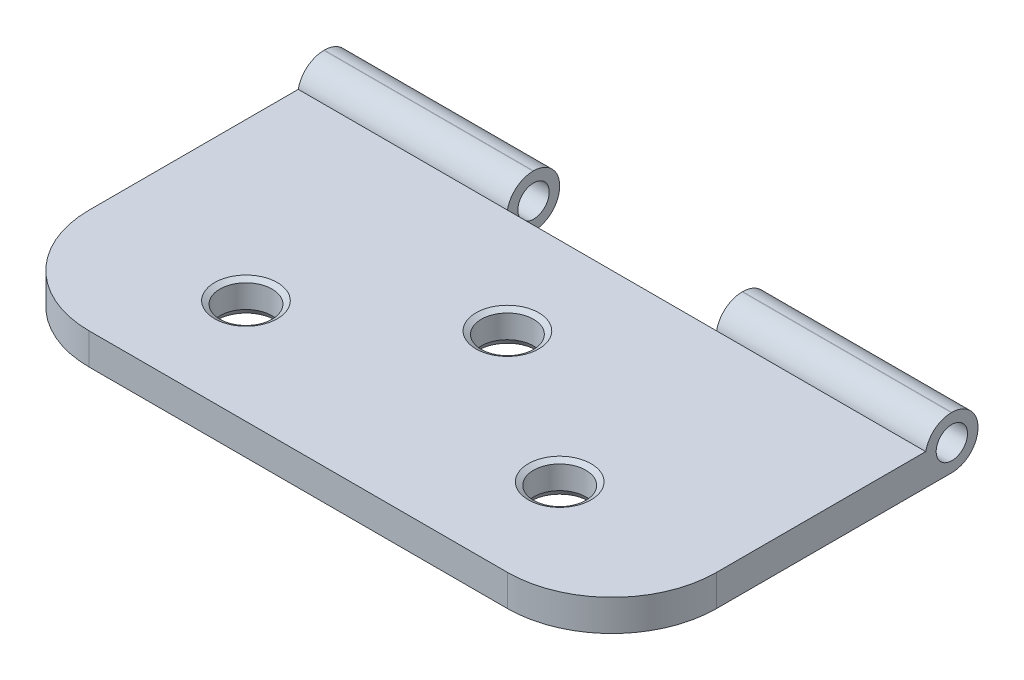
from build123d import *
from OCP.BRepFilletAPI import BRepFilletAPI_MakeChamfer

# Parameters (mm, degrees)
SZKIC1_W                    = 60
SZKIC1_H                    = 30
DODANIE_WYCI_GNI_CIE1_DEPTH = 3
SZKIC2_R                    = 2.5
WYTNIJ_WYCI_GNI_CIE1_DEPTH  = 5
SZKIC4_W                    = 20
SZKIC4_H                    = 3
DODANIE_WYCI_GNI_CIE2_DEPTH = 5
SZKIC5_W                    = 20
SZKIC5_H                    = 5
DODANIE_WYCI_GNI_CIE3_DEPTH = 2
ZAOKR_GLENIE1_R             = 2.5
SZKIC6_R                    = 1.5
WYTNIJ_WYCI_GNI_CIE2_DEPTH  = 60
ZAOKR_GLENIE2_R             = 10
SFAZOWANIE1_SIZE            = 0.5
SFAZOWANIE1_SIZE2           = 0.288675135


with BuildPart() as part:
    # Szkic1 → Dodanie-wyciągnięcie1 (new body)
    with BuildSketch(Plane(origin=(0, 0, 0), x_dir=(1, 0, 0), z_dir=(0, 1, 0))):
        Rectangle(SZKIC1_W, SZKIC1_H)
    extrude(amount=DODANIE_WYCI_GNI_CIE1_DEPTH)

    # Szkic2 → Wytnij-wyciągnięcie1 (cut)
    with BuildSketch(Plane(origin=(0, 3, 0), x_dir=(1, 0, 0), z_dir=(0, 1, 0))):
        with Locations(Location((-15, -5, 0), (0, 0, 270))):
            Circle(SZKIC2_R)
        with Locations(Location((15, -5, 0), (0, 0, 270))):
            Circle(SZKIC2_R)
        with Locations(Location((0, 5, 0), (0, 0, 270))):
            Circle(SZKIC2_R)
    extrude(amount=-WYTNIJ_WYCI_GNI_CIE1_DEPTH, mode=Mode.SUBTRACT)

    # Szkic4 → Dodanie-wyciągnięcie2 (add)
    with BuildSketch(Plane(origin=(0, 0, -15), x_dir=(-1, 0, 0), z_dir=(0, 0, -1))):
        with Locations((-20, 1.5)):
            Rectangle(SZKIC4_W, SZKIC4_H)
        with Locations((20, 1.5)):
            Rectangle(SZKIC4_W, SZKIC4_H)
    extrude(amount=DODANIE_WYCI_GNI_CIE2_DEPTH)

    # Szkic5 → Dodanie-wyciągnięcie3 (add)
    with BuildSketch(Plane(origin=(0, 3, 0), x_dir=(1, 0, 0), z_dir=(0, 1, 0))):
        with Locations((-20, 17.5)):
            Rectangle(SZKIC5_W, SZKIC5_H)
        with Locations((20, 17.5)):
            Rectangle(SZKIC5_W, SZKIC5_H)
    extrude(amount=DODANIE_WYCI_GNI_CIE3_DEPTH)

    # Zaokrąglenie1
    # the kernel refuses this fillet: 2.5 mm, written as the material it takes off along each edge
    with BuildSketch(Plane(origin=(-36.25, 0, -20), x_dir=(0, 1, 0), z_dir=(1, 0, 0)), Plane(origin=(-36.25, 5, -20), x_dir=(0, 0, 1), z_dir=(1, 0, 0)), Plane(origin=(3.75, 5, -20), x_dir=(0, 0, 1), z_dir=(1, 0, 0))) as zaokr_glenie1_piece_1:
        with BuildLine():
            CenterArc((ZAOKR_GLENIE1_R, ZAOKR_GLENIE1_R), ZAOKR_GLENIE1_R, 180, 90)
            Line((0, ZAOKR_GLENIE1_R), (-ZAOKR_GLENIE1_R * 0.02, ZAOKR_GLENIE1_R))
            Line((-ZAOKR_GLENIE1_R * 0.02, ZAOKR_GLENIE1_R), (-ZAOKR_GLENIE1_R * 0.02, -ZAOKR_GLENIE1_R * 0.02))
            Line((-ZAOKR_GLENIE1_R * 0.02, -ZAOKR_GLENIE1_R * 0.02), (ZAOKR_GLENIE1_R, -ZAOKR_GLENIE1_R * 0.02))
            Line((ZAOKR_GLENIE1_R, -ZAOKR_GLENIE1_R * 0.02), (ZAOKR_GLENIE1_R, 0))
        make_face()
    extrude(amount=32.5, mode=Mode.SUBTRACT)
    with BuildSketch(Plane(origin=(-3.876275643, 5, -15), x_dir=(0, -1.0, -1.666222715356868e-12), z_dir=(-1, 0, 0)), Plane(origin=(36.123724357, 5, -15), x_dir=(0, -1.0, -1.666222715356868e-12), z_dir=(-1, 0, 0))) as zaokr_glenie1_piece_2:
        with BuildLine():
            CenterArc((2.5, -2.449489743), ZAOKR_GLENIE1_R, 101.536959033, 78.463040967)
            Line((0, -2.449489743), (-0.05, -2.449489743))
            Line((-0.05, -2.449489743), (-0.05, 0))
            Line((-0.05, 0), (0, 0.05))
            ThreePointArc((0, 0.05), (1, 0.05), (1.99, 0.048989795))
            Line((1.99, 0.048989795), (2, 0))
        make_face()
    extrude(amount=32.247448714, mode=Mode.SUBTRACT)
    with BuildSketch(Plane(origin=(36.25, 0, -20), x_dir=(0, 1, 0), z_dir=(-1, 0, 0))) as zaokr_glenie1_piece_3:
        with BuildLine():
            CenterArc((ZAOKR_GLENIE1_R, -ZAOKR_GLENIE1_R), ZAOKR_GLENIE1_R, 90, 90)
            Line((0, -ZAOKR_GLENIE1_R), (-ZAOKR_GLENIE1_R * 0.02, -ZAOKR_GLENIE1_R))
            Line((-ZAOKR_GLENIE1_R * 0.02, -ZAOKR_GLENIE1_R), (-ZAOKR_GLENIE1_R * 0.02, ZAOKR_GLENIE1_R * 0.02))
            Line((-ZAOKR_GLENIE1_R * 0.02, ZAOKR_GLENIE1_R * 0.02), (ZAOKR_GLENIE1_R, ZAOKR_GLENIE1_R * 0.02))
            Line((ZAOKR_GLENIE1_R, ZAOKR_GLENIE1_R * 0.02), (ZAOKR_GLENIE1_R, 0))
        make_face()
    extrude(amount=32.5, mode=Mode.SUBTRACT)

    # Szkic6 → Wytnij-wyciągnięcie2 (cut)
    with BuildSketch(Plane(origin=(30, 0, 0), x_dir=(0, 0, -1), z_dir=(1, 0, 0))):
        with Locations((17.5, 2.5)):
            Circle(SZKIC6_R)
    extrude(amount=-WYTNIJ_WYCI_GNI_CIE2_DEPTH, mode=Mode.SUBTRACT)

    # Zaokrąglenie2
    zaokr_glenie2_edges = [part.edges().sort_by_distance(p)[0] for p in [
        (30, 1.5, 15),
        (-30, 1.5, 15),
    ]]
    fillet(zaokr_glenie2_edges, radius=ZAOKR_GLENIE2_R)

    # Sfazowanie1: one chamfer whose edges measure the first distance from different faces: ONE call of the kernel's chamfer builder (chamfer() names one face for all edges)
    sfazowanie1_edges_1 = [part.edges().sort_by_distance(p)[0] for p in [
        (-15, 0, 2.5),
    ]]
    sfazowanie1_side_1 = [part.faces().sort_by_distance(p)[0] for p in [
        (-15, 1.5, 2.5),
    ]]
    sfazowanie1_edges_2 = [part.edges().sort_by_distance(p)[0] for p in [
        (-15, 3, 2.5),
        (15, 3, 2.5),
        (0, 3, -7.5),
    ]]
    sfazowanie1_side_2 = [part.faces().sort_by_distance(p)[0] for p in [
        (0, 3, -0.380473171),
    ]]
    sfazowanie1_edges_3 = [part.edges().sort_by_distance(p)[0] for p in [
        (15, 0, 2.5),
    ]]
    sfazowanie1_side_3 = [part.faces().sort_by_distance(p)[0] for p in [
        (15, 1.5, 2.5),
    ]]
    sfazowanie1_edges_4 = [part.edges().sort_by_distance(p)[0] for p in [
        (0, 0, -7.5),
    ]]
    sfazowanie1_side_4 = [part.faces().sort_by_distance(p)[0] for p in [
        (0, 1.5, -7.5),
    ]]
    sfazowanie1 = BRepFilletAPI_MakeChamfer(part.part.solid().wrapped)
    for e in sfazowanie1_edges_1:
        sfazowanie1.Add(SFAZOWANIE1_SIZE, SFAZOWANIE1_SIZE2, e.wrapped, sfazowanie1_side_1[0].wrapped)  # the first distance lies on this face
    for e in sfazowanie1_edges_2:
        sfazowanie1.Add(SFAZOWANIE1_SIZE, SFAZOWANIE1_SIZE2, e.wrapped, sfazowanie1_side_2[0].wrapped)  # the first distance lies on this face
    for e in sfazowanie1_edges_3:
        sfazowanie1.Add(SFAZOWANIE1_SIZE, SFAZOWANIE1_SIZE2, e.wrapped, sfazowanie1_side_3[0].wrapped)  # the first distance lies on this face
    for e in sfazowanie1_edges_4:
        sfazowanie1.Add(SFAZOWANIE1_SIZE, SFAZOWANIE1_SIZE2, e.wrapped, sfazowanie1_side_4[0].wrapped)  # the first distance lies on this face
    add(Compound.cast(sfazowanie1.Shape()), mode=Mode.REPLACE)


solid = part.part
